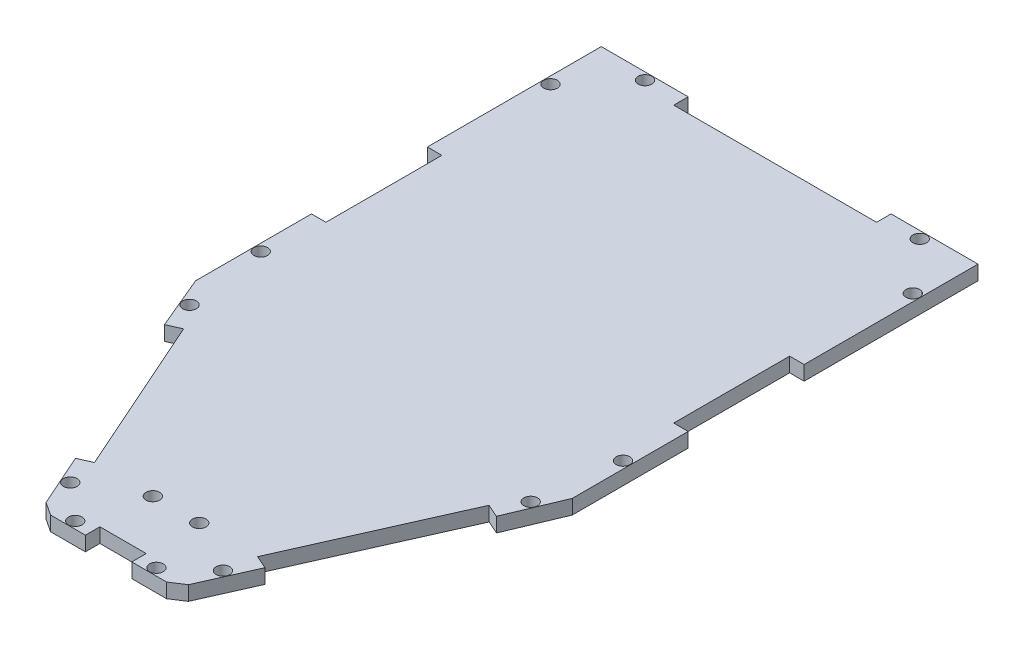
from build123d import *

# Parameters (mm, degrees)
BOSS_EXTRUDE1_DEPTH = 3.175
SKETCH2_R           = 1.5
SKETCH2_R_2         = 1.500000048
CUT_EXTRUDE1_DEPTH  = 99.065877093
SKETCH3_R           = 1.500000048
CUT_EXTRUDE2_DEPTH  = 99.065877093
SKETCH4_R           = 1.5
CUT_EXTRUDE3_DEPTH  = 99.065877093


with BuildPart() as part:
    # Sketch1 → Boss-Extrude1 (new body)
    with BuildSketch(Plane(origin=(0, 0, 0), x_dir=(1, 0, 0), z_dir=(0, 1, 0))):
        Polygon((-41.275, 0), (-36.368301991, -11.713851401), (-33.466950324, -10.424361771), (-17.857958519, -45.544593333), (-20.759310186, -46.834082962), (-15.601351667, -58.43948963), (-12.7, -60.325), (-5.08, -60.325), (-5.08, -57.15), (5.08, -57.15), (5.08, -60.325), (12.7, -60.325), (15.601351667, -58.43948963), (20.759310186, -46.834082962), (17.857958519, -45.544593333), (33.466950324, -10.424361771), (36.368301991, -11.713851401), (41.275, 0), (41.275, 25.4), (38.1, 25.4), (38.1, 50.8), (41.275, 50.8), (41.275, 88.9), (22.225, 88.9), (22.225, 85.725), (-22.225, 85.725), (-22.225, 88.9), (-41.275, 88.9), (-41.275, 50.8), (-38.1, 50.8), (-38.1, 25.4), (-41.275, 25.4), align=None)
    extrude(amount=BOSS_EXTRUDE1_DEPTH)

    # Sketch2 → Cut-Extrude1 (cut, through all)
    with BuildSketch(Plane(origin=(0, 0, 0), x_dir=(-1, 0, 0), z_dir=(0, -1, 0))):
        with Locations((39.6875, 76.2)):
            Circle(SKETCH2_R)
        with Locations((-8.89, -58.7375)):
            Circle(SKETCH2_R_2)
        with Locations((39.6875, 12.7)):
            Circle(SKETCH2_R_2)
        with Locations((37.371544878, -5.210820791)):
            Circle(SKETCH2_R_2)
        with Locations((16.729655093, -51.992041481)):
            Circle(SKETCH2_R_2)
        with Locations((8.89, -58.7375)):
            Circle(SKETCH2_R_2)
        with Locations((-16.729655093, -51.992041481)):
            Circle(SKETCH2_R_2)
        with Locations((-37.371544878, -5.210820791)):
            Circle(SKETCH2_R_2)
        with Locations((-39.6875, 12.7)):
            Circle(SKETCH2_R_2)
        with Locations((-39.6875, 76.2)):
            Circle(SKETCH2_R)
    extrude(amount=-CUT_EXTRUDE1_DEPTH, mode=Mode.SUBTRACT)

    # Sketch3 → Cut-Extrude2 (cut, through all)
    with BuildSketch(Plane.XZ):
        with Locations((-30.099, -87.3125)):
            Circle(SKETCH3_R)
        with Locations((30.099, -87.3125)):
            Circle(SKETCH3_R)
    extrude(amount=-CUT_EXTRUDE2_DEPTH, mode=Mode.SUBTRACT)

    # Sketch4 → Cut-Extrude3 (cut, through all)
    with BuildSketch(Plane.XZ):
        with Locations((5.08, 45.544593333)):
            Circle(SKETCH4_R)
        with Locations((-5.08, 45.544593333)):
            Circle(SKETCH4_R)
    extrude(amount=-CUT_EXTRUDE3_DEPTH, mode=Mode.SUBTRACT)


solid = part.part
